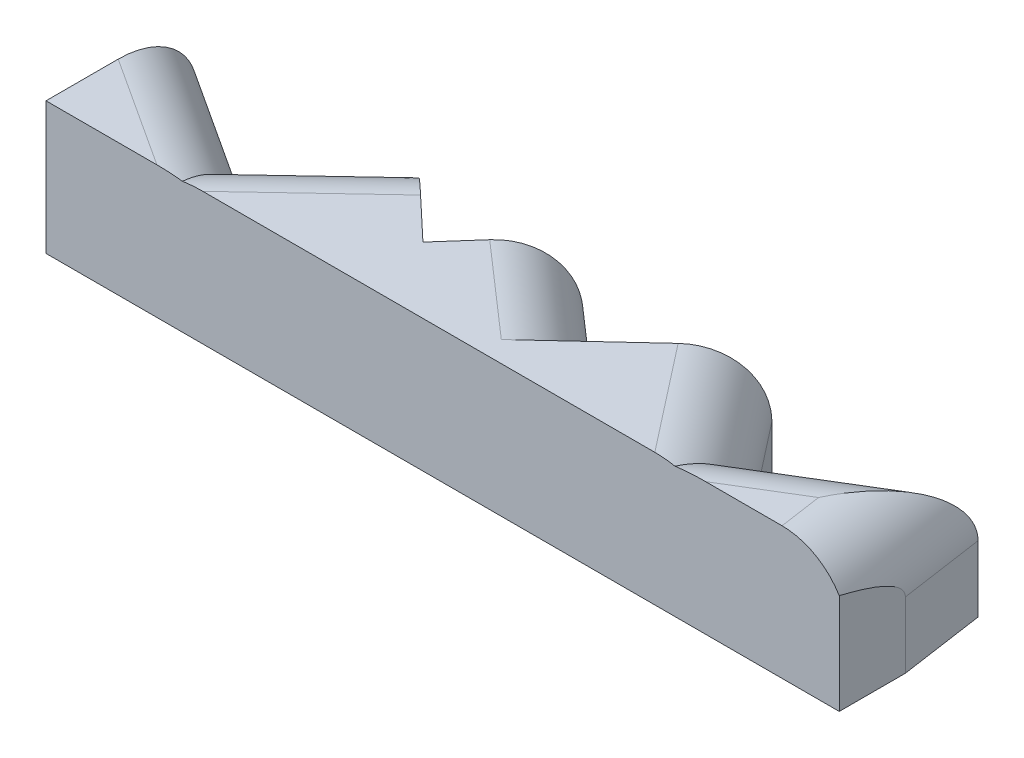
from build123d import *

# Parameters (mm, degrees)
SKETCH1_W           = 152.4
SKETCH1_H           = 12.7
BOSS_EXTRUDE1_DEPTH = 25.4
BOSS_EXTRUDE2_DEPTH = 25.4
FILLET2_R           = 12.7


with BuildPart() as part:
    # Sketch1 → Boss-Extrude1 (new body)
    with BuildSketch(Plane(origin=(0, 129.522150418, 0), x_dir=(1, 0, 0), z_dir=(0, 1, 0))):
        with Locations((43.851863223, -12.926286206)):
            Rectangle(SKETCH1_W, SKETCH1_H)
    extrude(amount=-BOSS_EXTRUDE1_DEPTH)

    # Sketch2 → Boss-Extrude2 (add)
    with BuildSketch(Plane(origin=(0, 129.522150418, 0), x_dir=(1, 0, 0), z_dir=(0, 1, 0))):
        Polygon((-32.348136777, -6.576286206), (-32.348136777, 9.752049173), (-7.268775287, -6.576286206), (10.057684935, 9.752049173), (27.370150986, -6.576286206), (41.790569064, 9.752049173), (60.472332517, -6.576286206), (78.078963356, 9.752049173), (90.818027749, -6.576286206), (117.678669506, 9.752049173), (120.051863223, -6.576286206), (120.051863223, -10.496577103), (-32.348136777, -10.496577103), align=None)
    extrude(amount=-BOSS_EXTRUDE2_DEPTH)

    # Fillet2
    # the kernel refuses this fillet: 12.7 mm, written as the material it takes off along each edge
    with BuildSketch(Plane(origin=(-58.955745883, 129.522150418, -27.075375577), x_dir=(0, -1, 0), z_dir=(0.8380349324532734, 0, 0.5456165796491502))) as fillet2_piece_1_section:
        with BuildLine():
            CenterArc((FILLET2_R, -FILLET2_R), FILLET2_R, 90, 90)
            Line((0, -FILLET2_R), (0, 0))
            Line((0, 0), (FILLET2_R, 0))
        make_face()
    fillet2_piece_1 = extrude(amount=93.426391514, mode=Mode.PRIVATE)
    fillet2_piece_1 = split(fillet2_piece_1, bisect_by=Plane(origin=(-14.62978652, 126.629320204, 13.5132519), z_dir=(-0.6858340421816573, 0, -0.7277579725326055)), keep=Keep.TOP, mode=Mode.PRIVATE)
    add(fillet2_piece_1, mode=Mode.SUBTRACT)
    with BuildSketch(Plane(origin=(-30.375090914, 129.522150418, 28.351517045), x_dir=(0, -1, 0), z_dir=(0.7277579725326055, 0, -0.6858340421816573))) as fillet2_piece_2_section:
        with BuildLine():
            CenterArc((FILLET2_R, -FILLET2_R), FILLET2_R, 90, 90)
            Line((0, -FILLET2_R), (0, 0))
            Line((0, 0), (FILLET2_R, 0))
        make_face()
    fillet2_piece_2 = extrude(amount=87.307997817, mode=Mode.PRIVATE)
    fillet2_piece_2 = split(fillet2_piece_2, bisect_by=Plane(origin=(0.600633599, 126.627355979, 11.699795733), z_dir=(0.5456165796491502, 0, -0.8380349324532734)), keep=Keep.TOP, mode=Mode.PRIVATE)
    add(fillet2_piece_2, mode=Mode.SUBTRACT)
    with BuildSketch(Plane(origin=(113.112040831, 129.522150418, -41.171921906), x_dir=(0, -1, 0), z_dir=(0.14383082440379222, 0, 0.9896022907973312))) as fillet2_piece_3:
        with BuildLine():
            CenterArc((FILLET2_R, -FILLET2_R), FILLET2_R, 90, 90)
            Line((0, -FILLET2_R), (0, 0))
            Line((0, 0), (FILLET2_R, 0))
        make_face()
    extrude(amount=79.999896505, mode=Mode.SUBTRACT)
    with BuildSketch(Plane(origin=(63.687529345, 129.522150418, 23.068664941), x_dir=(0, -1, 0), z_dir=(0.8545038867379449, 0, -0.5194449995425362))) as fillet2_piece_4_section:
        with BuildLine():
            CenterArc((FILLET2_R, -FILLET2_R), FILLET2_R, 90, 90)
            Line((0, -FILLET2_R), (0, 0))
            Line((0, 0), (FILLET2_R, 0))
        make_face()
    fillet2_piece_4 = extrude(amount=94.934194945, mode=Mode.PRIVATE)
    fillet2_piece_4 = split(fillet2_piece_4, bisect_by=Plane(origin=(94.83379058, 126.638697733, 11.723502696), z_dir=(0.7884329224399922, 0, -0.61512074165381)), keep=Keep.TOP, mode=Mode.PRIVATE)
    add(fillet2_piece_4, mode=Mode.SUBTRACT)
    with BuildSketch(Plane(origin=(58.548879808, 129.522150418, -34.784794461), x_dir=(0, -1, 0), z_dir=(0.61512074165381, 0, 0.7884329224399922))) as fillet2_piece_5_section:
        with BuildLine():
            CenterArc((FILLET2_R, -FILLET2_R), FILLET2_R, 90, 90)
            Line((0, -FILLET2_R), (0, 0))
            Line((0, 0), (FILLET2_R, 0))
        make_face()
    fillet2_piece_5 = extrude(amount=84.209859919, mode=Mode.PRIVATE)
    fillet2_piece_5 = split(fillet2_piece_5, bisect_by=Plane(origin=(85.773780616, 126.63700346, 9.642637325), z_dir=(-0.5194449995425363, 0, -0.8545038867379451)), keep=Keep.TOP, mode=Mode.PRIVATE)
    add(fillet2_piece_5, mode=Mode.SUBTRACT)
    with BuildSketch(Plane(origin=(17.884716168, 129.522150418, -30.646371305), x_dir=(0, -1, 0), z_dir=(0.7529402486677585, 0, 0.6580888860451405))) as fillet2_piece_6_section:
        with BuildLine():
            CenterArc((FILLET2_R, -FILLET2_R), FILLET2_R, 90, 90)
            Line((0, -FILLET2_R), (0, 0))
            Line((0, 0), (FILLET2_R, 0))
        make_face()
    fillet2_piece_6 = extrude(amount=88.311747661, mode=Mode.PRIVATE)
    fillet2_piece_6 = split(fillet2_piece_6, bisect_by=Plane(origin=(56.205808832, 126.638654996, 10.533047171), z_dir=(-0.6799885276956249, 0, -0.7332227507397301)), keep=Keep.TOP, mode=Mode.PRIVATE)
    add(fillet2_piece_6, mode=Mode.SUBTRACT)
    with BuildSketch(Plane(origin=(-58.955745883, 129.522150418, -27.075375577), x_dir=(0, -1, 0), z_dir=(0.8380349324532734, 0, 0.5456165796491502))) as fillet2_piece_7a_section:
        with BuildLine():
            CenterArc((FILLET2_R, -FILLET2_R), FILLET2_R, 90, 90)
            Line((0, -FILLET2_R), (0, 0))
            Line((0, 0), (FILLET2_R, 0))
        make_face()
    fillet2_piece_7a = extrude(amount=93.426391514, mode=Mode.PRIVATE)
    fillet2_piece_7a = split(fillet2_piece_7a, bisect_by=Plane(origin=(-6.679987246, 126.680031692, 6.021416459), z_dir=(0.6858340421816573, 0, 0.7277579725326055)), keep=Keep.TOP, mode=Mode.PRIVATE)
    with BuildSketch(Plane(origin=(-30.375090914, 129.522150418, 28.351517045), x_dir=(0, -1, 0), z_dir=(0.7277579725326055, 0, -0.6858340421816573))) as fillet2_piece_7b_section:
        with BuildLine():
            CenterArc((FILLET2_R, -FILLET2_R), FILLET2_R, 90, 90)
            Line((0, -FILLET2_R), (0, 0))
            Line((0, 0), (FILLET2_R, 0))
        make_face()
    fillet2_piece_7b = extrude(amount=87.307997817, mode=Mode.PRIVATE)
    fillet2_piece_7b = split(fillet2_piece_7b, bisect_by=Plane(origin=(-7.946782213, 126.680031692, 6.134858521), z_dir=(-0.5456165796491502, 0, 0.8380349324532734)), keep=Keep.TOP, mode=Mode.PRIVATE)
    fillet2_piece_7 = fillet2_piece_7a & fillet2_piece_7b
    add(fillet2_piece_7, mode=Mode.SUBTRACT)
    with BuildSketch(Plane(origin=(58.548879808, 129.522150418, -34.784794461), x_dir=(0, -1, 0), z_dir=(0.61512074165381, 0, 0.7884329224399922))) as fillet2_piece_8a_section:
        with BuildLine():
            CenterArc((FILLET2_R, -FILLET2_R), FILLET2_R, 90, 90)
            Line((0, -FILLET2_R), (0, 0))
            Line((0, 0), (FILLET2_R, 0))
        make_face()
    fillet2_piece_8a = extrude(amount=84.209859919, mode=Mode.PRIVATE)
    fillet2_piece_8a = split(fillet2_piece_8a, bisect_by=Plane(origin=(89.912348573, 126.663062173, 7.126840189), z_dir=(0.5194449995425363, 0, 0.8545038867379451)), keep=Keep.TOP, mode=Mode.PRIVATE)
    with BuildSketch(Plane(origin=(63.687529345, 129.522150418, 23.068664941), x_dir=(0, -1, 0), z_dir=(0.8545038867379449, 0, -0.5194449995425362))) as fillet2_piece_8b_section:
        with BuildLine():
            CenterArc((FILLET2_R, -FILLET2_R), FILLET2_R, 90, 90)
            Line((0, -FILLET2_R), (0, 0))
            Line((0, 0), (FILLET2_R, 0))
        make_face()
    fillet2_piece_8b = extrude(amount=94.934194945, mode=Mode.PRIVATE)
    fillet2_piece_8b = split(fillet2_piece_8b, bisect_by=Plane(origin=(91.469987388, 126.663062173, 7.4119375), z_dir=(-0.7884329224399922, 0, 0.61512074165381)), keep=Keep.TOP, mode=Mode.PRIVATE)
    fillet2_piece_8 = fillet2_piece_8a & fillet2_piece_8b
    add(fillet2_piece_8, mode=Mode.SUBTRACT)


solid = part.part
